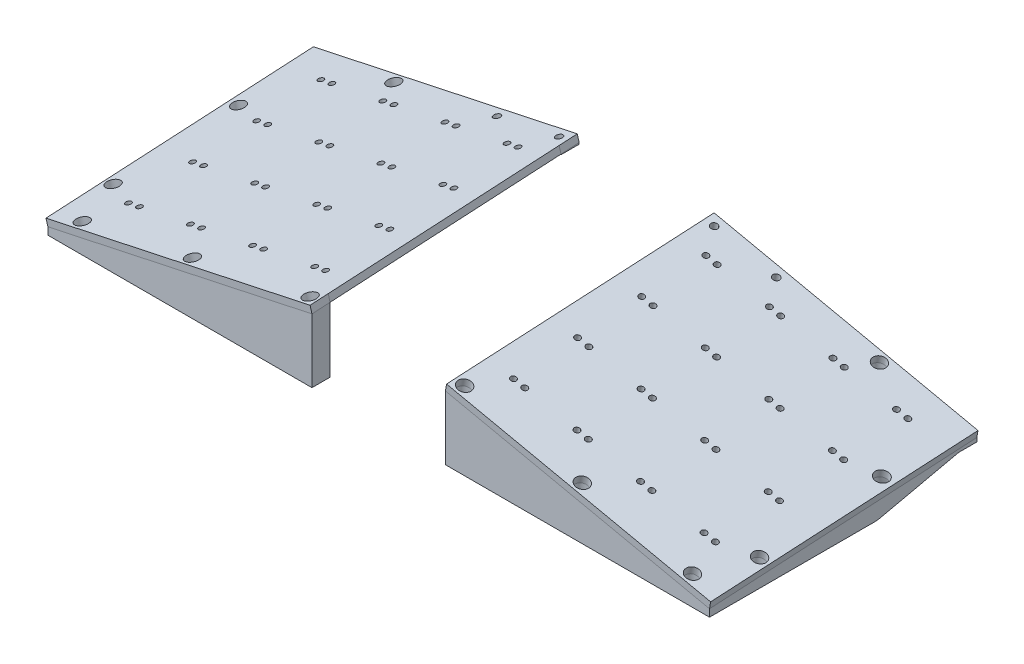
from build123d import *

# Parameters (mm, degrees)
SKETCH2_W           = 185.011000056
SKETCH2_H           = 70
BOSS_EXTRUDE1_DEPTH = 12.7
BOSS_EXTRUDE2_START = -12.7
BOSS_EXTRUDE2_DEPTH = 12.7
BOSS_EXTRUDE3_DEPTH = 12.7
CUT_EXTRUDE1_DEPTH  = 311.849671827
CUT_EXTRUDE2_DEPTH  = 282.68185931
SKETCH10_R          = 2.413
CUT_EXTRUDE3_DEPTH  = 318.257789318
CUT_EXTRUDE4_START  = -4.7625
SKETCH11_R          = 4.572
CUT_EXTRUDE4_DEPTH  = 299.284875892
SKETCH12_RX         = 2.413
SKETCH12_RY         = 2.399825014
CUT_EXTRUDE5_DEPTH  = 308.775691268
SKETCH13_R          = 2.413
CUT_EXTRUDE6_DEPTH  = 298.712079814
SKETCH14_R          = 2.413
CUT_EXTRUDE7_DEPTH  = 289.738598097
CUT_EXTRUDE8_START  = -4.7625
SKETCH15_R          = 4.572
CUT_EXTRUDE8_DEPTH  = 293.949579814
CUT_EXTRUDE9_START  = -4.7625
SKETCH16_R          = 4.572
CUT_EXTRUDE9_DEPTH  = 304.01319143
BOSS_EXTRUDE4_DEPTH = 5
SKETCH18_R          = 2
CUT_EXTRUDE10_DEPTH = 295.650700449


# Read off the part's stored shape, not the designer's step: Boss-Extrude4
with BuildPart() as part:
    # Sketch2 → Boss-Extrude1 (new body)
    with BuildSketch(Plane.XY):
        with Locations((139.269499972, 53.415)):
            Rectangle(SKETCH2_W, SKETCH2_H)
    extrude(amount=-BOSS_EXTRUDE1_DEPTH)



with BuildPart() as body_2:
    # Sketch3 → Boss-Extrude2 (new body)
    with BuildSketch(Plane(origin=(0, 0, -187.325), x_dir=(-1, 0, 0), z_dir=(0, 0, -1)).offset(BOSS_EXTRUDE2_START)):
        with BuildLine():
            Line((-110.593474069, 55.793664812), (-46.890999944, 72.382979699))
            Line((-46.890999944, 72.382979699), (-46.890999944, 88.415))
            Line((-46.890999944, 88.415), (-231.775, 88.415))
            Line((-231.775, 88.415), (-231.775, 31.115))
            Line((-231.775, 31.115), (-219.075, 31.115))
            Line((-219.075, 31.115), (-147.523503366, 35.070220533))
            ThreePointArc((-147.523503366, 35.070220533), (-134.07992752, 38.328271897), (-122.685614768, 46.171375053))
            Line((-122.685614768, 46.171375053), (-116.373160601, 52.48382922))
            ThreePointArc((-116.373160601, 52.48382922), (-113.704154884, 54.524376988), (-110.593474069, 55.793664812))
        make_face()
    extrude(amount=BOSS_EXTRUDE2_DEPTH)


with BuildPart() as part_1:
    add(part.part)

    add(body_2.part)  # Boss-Extrude3 merges body 2
    # Sketch4 → Boss-Extrude3 (add)
    with BuildSketch(Plane(origin=(231.775, 0, 0), x_dir=(0, 0, -1), z_dir=(1, 0, 0))):
        Polygon((12.7, 88.415), (174.625, 88.415), (174.62999458, 31.06950051), (173.808454294, 30.933545399), (118.291545706, 18.596454601), (116.638535618, 18.415), (12.7, 18.415), align=None)
    extrude(amount=-BOSS_EXTRUDE3_DEPTH)

    # Sketch5 → Cut-Extrude1 (cut, through all)
    with BuildSketch(Plane(origin=(0, 0, -187.325), x_dir=(-1, 0, 0), z_dir=(0, 0, -1))):
        Polygon((-231.775, 88.415), (-46.763999944, 88.415), (-46.763999944, 75.762394189), (-231.775, 36.115), align=None)
    extrude(amount=-CUT_EXTRUDE1_DEPTH, mode=Mode.SUBTRACT)

    # Sketch8 → Cut-Extrude2 (cut, through all)
    with BuildSketch(Plane(origin=(217.825423799, -46.679443055, 0), x_dir=(0, 0, 1), z_dir=(0.9778000536306904, -0.20954010384606275, 0))):
        Polygon((-187.325, -81.632116926), (0, -71.572345557), (0, -83.879406506), (-187.325, -83.879406506), align=None)
    extrude(amount=-CUT_EXTRUDE2_DEPTH, mode=Mode.SUBTRACT)

    # Sketch10 → Cut-Extrude3 (cut, through all)
    with BuildSketch(Plane.XZ.offset(35.385000096)):
        with Locations((53.113999944, -6.35)):
            Circle(SKETCH10_R)
        with Locations((135.522999972, -6.35)):
            Circle(SKETCH10_R)
        with Locations((212.725, -6.35)):
            Circle(SKETCH10_R)
        with Locations((225.425, -40.64)):
            Circle(SKETCH10_R)
    extrude(amount=-CUT_EXTRUDE3_DEPTH, mode=Mode.SUBTRACT)

    # Sketch11 → Cut-Extrude4 (cut, through all)
    with BuildSketch(Plane.XZ.offset(-18.415).offset(CUT_EXTRUDE4_START)):
        with Locations((53.113999944, -6.35)):
            Circle(SKETCH11_R)
        with Locations((135.522999972, -6.35)):
            Circle(SKETCH11_R)
        with Locations((212.725, -6.35)):
            Circle(SKETCH11_R)
        with Locations((225.425, -40.64)):
            Circle(SKETCH11_R)
    extrude(amount=-CUT_EXTRUDE4_DEPTH, mode=Mode.SUBTRACT)

    # Sketch12 → Cut-Extrude5 (cut, through all)
    with BuildSketch(Plane(origin=(0, -7.328647059, -1.628588235), x_dir=(1, 0, 0), z_dir=(0, -0.9761870601839528, -0.21693045781865625))):
        with Locations(Location((224.327946674, -131.339918715), (0, 0, -91.693257036))):
            Ellipse(SKETCH12_RX, SKETCH12_RY)
    extrude(amount=-CUT_EXTRUDE5_DEPTH, mode=Mode.SUBTRACT)

    # Sketch13 → Cut-Extrude6 (cut, through all)
    with BuildSketch(Plane(origin=(2.382111788, 43.093340092, 0), x_dir=(0.9984756662390543, -0.055193694644196545, 0), z_dir=(-0.05519369464419654, -0.9984756662390541, 0))):
        with Locations((166.215099946, -180.975)):
            Circle(SKETCH13_R)
    extrude(amount=-CUT_EXTRUDE6_DEPTH, mode=Mode.SUBTRACT)

    # Sketch14 → Cut-Extrude7 (cut, through all)
    with BuildSketch(Plane(origin=(20.630792738, 79.22162847, 0), x_dir=(0.9677237569067885, -0.2520133534521754, 0), z_dir=(-0.25201335345217535, -0.9677237569067884, 0))):
        with Locations((33.486057184, -180.975)):
            Circle(SKETCH14_R)
        with Locations((77.936057184, -180.975)):
            Circle(SKETCH14_R)
    extrude(amount=-CUT_EXTRUDE7_DEPTH, mode=Mode.SUBTRACT)

    # Sketch15 → Cut-Extrude8 (cut, through all)
    with BuildSketch(Plane(origin=(2.382111788, 43.093340092, 0), x_dir=(0.9984756662390543, -0.055193694644196545, 0), z_dir=(-0.05519369464419654, -0.9984756662390541, 0)).offset(CUT_EXTRUDE8_START)):
        with Locations((166.215099946, -180.975)):
            Circle(SKETCH15_R)
    extrude(amount=-CUT_EXTRUDE8_DEPTH, mode=Mode.SUBTRACT)

    # Sketch16 → Cut-Extrude9 (cut, through all)
    with BuildSketch(Plane(origin=(0, -7.328647059, -1.628588235), x_dir=(1, 0, 0), z_dir=(0, -0.9761870601839528, -0.21693045781865625)).offset(CUT_EXTRUDE9_START)):
        with Locations(Location((224.327946674, -131.339918715, 0), (0, 0, 270))):
            Circle(SKETCH16_R)
    extrude(amount=-CUT_EXTRUDE9_DEPTH, mode=Mode.SUBTRACT)

    # Boss-Extrude4 outline → Boss-Extrude4 (add)
    with BuildSketch(Plane(origin=(14.954149996, 69.782196343, 3.832542212), x_dir=(0.9778646151862689, -0.20892374788255796, -0.011474403571240216), z_dir=(0.20923860630058294, 0.9763931424441029, 0.0536249664011048))):
        Polygon((32.659786899, 178.351170208), (32.529912069, 16.183633708), (32.529912069, 3.46449418), (221.728904632, 1.290276862), (221.728904632, 188.897584899), (32.659786899, 191.070309735), align=None)
        with BuildLine():
            add(Edge.make_bspline(
                [(43.552770644, 8.560625476), (41.542292334, 0.901152324), (35.753855826, 6.514110448), (29.965419319, 12.127068571), (37.764334136, 14.1735836), (45.563248954, 16.220098628), (43.552770644, 8.560625476)],
                knots=[0, 0, 0, 2.094395102, 2.094395102, 4.188790205, 4.188790205, 6.283185307, 6.283185307, 6.283185307], degree=2, weights=[1, 0.5, 1, 0.5, 1, 0.5, 1]))
        make_face(mode=Mode.SUBTRACT)
        with BuildLine():
            add(Edge.make_bspline(
                [(127.827217994, 7.592169141), (125.816739684, -0.067304011), (120.028303176, 5.545654113), (114.239866669, 11.158612236), (122.038781486, 13.205127265), (129.837696304, 15.251642293), (127.827217994, 7.592169141)],
                knots=[0, 0, 0, 2.094395102, 2.094395102, 4.188790205, 4.188790205, 6.283185307, 6.283185307, 6.283185307], degree=2, weights=[1, 0.5, 1, 0.5, 1, 0.5, 1]))
        make_face(mode=Mode.SUBTRACT)
        with BuildLine():
            add(Edge.make_bspline(
                [(206.776797342, 6.684904571), (204.766319032, -0.974568581), (198.977882524, 4.638389542), (193.189446016, 10.251347666), (200.988360834, 12.297862694), (208.787275652, 14.344377723), (206.776797342, 6.684904571)],
                knots=[0, 0, 0, 2.094395102, 2.094395102, 4.188790205, 4.188790205, 6.283185307, 6.283185307, 6.283185307], degree=2, weights=[1, 0.5, 1, 0.5, 1, 0.5, 1]))
        make_face(mode=Mode.SUBTRACT)
        with BuildLine():
            add(Edge.make_bspline(
                [(219.764280274, 40.87733309), (217.753801964, 33.217859938), (211.965365457, 38.830818061), (206.176928949, 44.443776185), (213.975843767, 46.490291213), (221.774758585, 48.536806242), (219.764280274, 40.87733309)],
                knots=[0, 0, 0, 2.094395102, 2.094395102, 4.188790205, 4.188790205, 6.283185307, 6.283185307, 6.283185307], degree=2, weights=[1, 0.5, 1, 0.5, 1, 0.5, 1]))
        make_face(mode=Mode.SUBTRACT)
        with BuildLine():
            add(Edge.make_bspline(
                [(37.644189703, 182.778023446), (34.434361166, 185.454720621), (38.362917241, 186.902825373), (42.291473315, 188.350930124), (41.572745777, 184.226128198), (40.85401824, 180.101326272), (37.644189703, 182.778023446)],
                knots=[0, 0, 0, 2.094395102, 2.094395102, 4.188790205, 4.188790205, 6.283185307, 6.283185307, 6.283185307], degree=2, weights=[1, 0.5, 1, 0.5, 1, 0.5, 1]))
        make_face(mode=Mode.SUBTRACT)
        with BuildLine():
            add(Edge.make_bspline(
                [(82.1336425, 182.266764177), (78.923813963, 184.943461351), (82.852370038, 186.391566103), (86.780926112, 187.839670855), (86.062198575, 183.714868929), (85.343471037, 179.590067002), (82.1336425, 182.266764177)],
                knots=[0, 0, 0, 2.094395102, 2.094395102, 4.188790205, 4.188790205, 6.283185307, 6.283185307, 6.283185307], degree=2, weights=[1, 0.5, 1, 0.5, 1, 0.5, 1]))
        make_face(mode=Mode.SUBTRACT)
        with BuildLine():
            add(Edge.make_bspline(
                [(217.831956791, 131.912934405), (222.74062034, 125.698871792), (214.708268047, 124.399667163), (206.675915753, 123.100462533), (209.799604498, 130.613729776), (212.923293243, 138.126997019), (217.831956791, 131.912934405)],
                knots=[0, 0, 0, 2.094395102, 2.094395102, 4.188790205, 4.188790205, 6.283185307, 6.283185307, 6.283185307], degree=2, weights=[1, 0.5, 1, 0.5, 1, 0.5, 1]))
        make_face(mode=Mode.SUBTRACT)
        with BuildLine():
            add(Edge.make_bspline(
                [(161.965059567, 181.727969077), (159.321804881, 174.263201387), (154.089977031, 180.31614655), (148.858149181, 186.369091712), (156.733231717, 187.78091424), (164.608314253, 189.192736767), (161.965059567, 181.727969077)],
                knots=[0, 0, 0, 2.094395102, 2.094395102, 4.188790205, 4.188790205, 6.283185307, 6.283185307, 6.283185307], degree=2, weights=[1, 0.5, 1, 0.5, 1, 0.5, 1]))
        make_face(mode=Mode.SUBTRACT)
    extrude(amount=BOSS_EXTRUDE4_DEPTH)

    # Sketch18 → Cut-Extrude10 (cut, through all)
    with BuildSketch(Plane(origin=(16.000343028, 74.664162055, 4.100667044), x_dir=(0.977864615186269, -0.208923747882558, -0.011474403571240212), z_dir=(0.20923860630058294, 0.9763931424441029, 0.053624966401104764))):
        with Locations(Location((50.90492044, 167.199423253, 0), (0, 0, 179.341603297))):
            Circle(SKETCH18_R)
        with Locations(Location((58.90492044, 167.199423253, 0), (0, 0, 179.341603297))):
            Circle(SKETCH18_R)
        with Locations(Location((95.90492044, 167.199423253, 0), (0, 0, 179.341603297))):
            Circle(SKETCH18_R)
        with Locations(Location((103.90492044, 167.199423253, 0), (0, 0, 179.341603297))):
            Circle(SKETCH18_R)
        with Locations(Location((140.90492044, 167.199423253, 0), (0, 0, 179.341603297))):
            Circle(SKETCH18_R)
        with Locations(Location((148.90492044, 167.199423253, 0), (0, 0, 179.341603297))):
            Circle(SKETCH18_R)
        with Locations(Location((185.90492044, 167.199423253, 0), (0, 0, 179.341603297))):
            Circle(SKETCH18_R)
        with Locations(Location((193.90492044, 167.199423253, 0), (0, 0, 179.341603297))):
            Circle(SKETCH18_R)
        with Locations(Location((95.90492044, 122.199423253, 0), (0, 0, 179.341603297))):
            Circle(SKETCH18_R)
        with Locations(Location((103.90492044, 122.199423253, 0), (0, 0, 179.341603297))):
            Circle(SKETCH18_R)
        with Locations(Location((140.90492044, 122.199423253, 0), (0, 0, 179.341603297))):
            Circle(SKETCH18_R)
        with Locations(Location((148.90492044, 122.199423253, 0), (0, 0, 179.341603297))):
            Circle(SKETCH18_R)
        with Locations(Location((185.90492044, 122.199423253, 0), (0, 0, 179.341603297))):
            Circle(SKETCH18_R)
        with Locations(Location((193.90492044, 122.199423253, 0), (0, 0, 179.341603297))):
            Circle(SKETCH18_R)
        with Locations(Location((95.90492044, 77.199423253, 0), (0, 0, 179.341603297))):
            Circle(SKETCH18_R)
        with Locations(Location((103.90492044, 77.199423253, 0), (0, 0, 179.341603297))):
            Circle(SKETCH18_R)
        with Locations(Location((140.90492044, 77.199423253, 0), (0, 0, 179.341603297))):
            Circle(SKETCH18_R)
        with Locations(Location((148.90492044, 77.199423253, 0), (0, 0, 179.341603297))):
            Circle(SKETCH18_R)
        with Locations(Location((185.90492044, 77.199423253, 0), (0, 0, 179.341603297))):
            Circle(SKETCH18_R)
        with Locations(Location((193.90492044, 77.199423253, 0), (0, 0, 179.341603297))):
            Circle(SKETCH18_R)
        with Locations(Location((95.90492044, 32.199423253, 0), (0, 0, 179.341603297))):
            Circle(SKETCH18_R)
        with Locations(Location((103.90492044, 32.199423253, 0), (0, 0, 179.341603297))):
            Circle(SKETCH18_R)
        with Locations(Location((140.90492044, 32.199423253, 0), (0, 0, 179.341603297))):
            Circle(SKETCH18_R)
        with Locations(Location((148.90492044, 32.199423253, 0), (0, 0, 179.341603297))):
            Circle(SKETCH18_R)
        with Locations(Location((185.90492044, 32.199423253, 0), (0, 0, 179.341603297))):
            Circle(SKETCH18_R)
        with Locations(Location((193.90492044, 32.199423253, 0), (0, 0, 179.341603297))):
            Circle(SKETCH18_R)
        with Locations(Location((50.90492044, 122.199423253, 0), (0, 0, 179.341603297))):
            Circle(SKETCH18_R)
        with Locations(Location((58.90492044, 122.199423253, 0), (0, 0, 179.341603297))):
            Circle(SKETCH18_R)
        with Locations(Location((50.90492044, 77.199423253, 0), (0, 0, 179.341603297))):
            Circle(SKETCH18_R)
        with Locations(Location((58.90492044, 77.199423253, 0), (0, 0, 179.341603297))):
            Circle(SKETCH18_R)
        with Locations(Location((50.90492044, 32.199423253, 0), (0, 0, 179.341603297))):
            Circle(SKETCH18_R)
        with Locations(Location((58.90492044, 32.199423253, 0), (0, 0, 179.341603297))):
            Circle(SKETCH18_R)
    extrude(amount=-CUT_EXTRUDE10_DEPTH, mode=Mode.SUBTRACT)


with BuildPart() as body_2_2:
    # Mirror3: mirrored copy
    add(part_1.part.mirror(Plane(origin=(0, 0, 0), x_dir=(0, 0, 1), z_dir=(1, 0, 0))))


solid = Compound([part_1.part, body_2_2.part])
